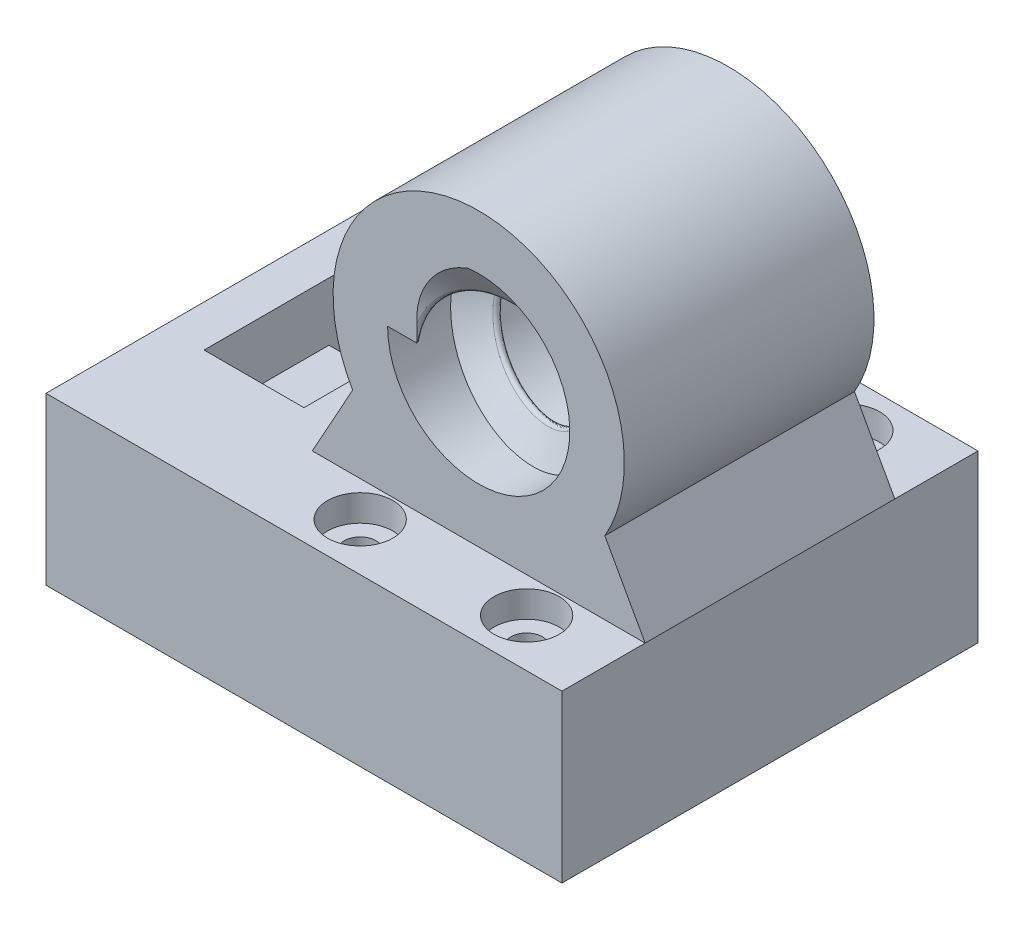
from build123d import *

# Parameters (mm, degrees)
SKETCH1_R           = 17.5
BOSS_EXTRUDE1_DEPTH = 30
SKETCH5_R           = 10.9500003
CUT_EXTRUDE2_DEPTH  = 39.890872965
SWEEP2_PITCH        = 10
SKETCH8_R           = 17.5
CUT_EXTRUDE3_DEPTH  = 41.699000034
SKETCH9_R           = 17.5
CUT_EXTRUDE4_DEPTH  = 39.890873595
SKETCH10_W          = 40
SKETCH10_H          = 19.97726246
BOSS_EXTRUDE2_DEPTH = 40
SKETCH11_W          = 40
SKETCH11_H          = 19.97726246
BOSS_EXTRUDE3_DEPTH = 10
BOSS_EXTRUDE4_DEPTH = 30
SKETCH14_R          = 1.905
CUT_EXTRUDE5_DEPTH  = 71.869594345
SKETCH15_R          = 3.9243
CUT_EXTRUDE7_DEPTH  = 59.798031253
SKETCH16_W          = 50
SKETCH16_H          = 19.97726246
BOSS_EXTRUDE5_DEPTH = 22
CUT_EXTRUDE8_DEPTH  = 12


with BuildPart() as part:
    # Sketch1 → Boss-Extrude1 (new body)
    with BuildSketch(Plane.XY):
        Circle(SKETCH1_R)
    extrude(amount=BOSS_EXTRUDE1_DEPTH)

    # Sketch5 → Cut-Extrude2 (cut, through all)
    with BuildSketch(Plane(origin=(0, 0, 0), x_dir=(-1, 0, 0), z_dir=(0, 0, -1))):
        Circle(SKETCH5_R)
    extrude(amount=-CUT_EXTRUDE2_DEPTH, mode=Mode.SUBTRACT)

    # Sweep2: arcs per turn and ends read off the stored shape
    # Sweep2: the profile of Sketch7 profile screwed along a right-hand helix through 3.75 turns, 16 arcs to a turn; built about Z, then put on its axis
    sweep2_z = Axis((0, 0, 0), (0, 0, 1))
    sweep2_corners = [(0, 7.7000003, 2.933012702), (0, 10.9503003, 4.809574282), (0, 10.9503003, 0.190425718), (0, 7.7000003, 2.066987298), (0, 7.4500003, 2.5)]
    with BuildLine(mode=Mode.PRIVATE) as sweep2_profile:
        Line(sweep2_corners[0], sweep2_corners[1])
        Line(sweep2_corners[1], sweep2_corners[2])
        Line(sweep2_corners[2], sweep2_corners[3])
        ThreePointArc((0, 7.7000003, 2.066987298), (0, 7.516987598, 2.25), (0, 7.4500003, 2.5))
        ThreePointArc((0, 7.4500003, 2.5), (0, 7.516987598, 2.75), (0, 7.7000003, 2.933012702))
    sweep2_cap = Face(sweep2_profile.wire())
    sweep2_arcs = [((0, 7.7000003, 2.066987298), (0, 7.4500003, 2.211324865), (0, 7.4500003, 2.5), (1, 0.8660254037844395, 1)), ((0, 7.4500003, 2.5), (0, 7.4500003, 2.788675135), (0, 7.7000003, 2.933012702), (1, 0.8660254037844395, 1))]  # start, shoulder, end, weights
    sweep2_turn_angles = [0, 11.25, 22.5, 33.75, 45, 56.25, 67.5, 78.75, 90, 101.25, 112.5, 123.75, 135, 146.25, 157.5, 168.75, 180, 191.25, 202.5, 213.75, 225, 236.25, 247.5, 258.75, 270, 281.25, 292.5, 303.75, 315, 326.25, 337.5, 348.75, 360]
    sweep2_turn_weights = [1, 0.9807852804032304, 1, 0.9807852804032304, 1, 0.9807852804032304, 1, 0.9807852804032304, 1, 0.9807852804032304, 1, 0.9807852804032304, 1, 0.9807852804032304, 1, 0.9807852804032304, 1, 0.9807852804032304, 1, 0.9807852804032304, 1, 0.9807852804032304, 1, 0.9807852804032304, 1, 0.9807852804032304, 1, 0.9807852804032304, 1, 0.9807852804032304, 1, 0.9807852804032304, 1]
    sweep2_turn_rails = [Edge.make_bspline([Vector(p[0], p[1], 0).rotate(sweep2_z, sweep2_turn_angles[k]) / sweep2_turn_weights[k] + Vector(0, 0, p[2] + SWEEP2_PITCH * sweep2_turn_angles[k] / 360) for k in range(33)], [0, 0, 0, 1, 1, 2, 2, 3, 3, 4, 4, 5, 5, 6, 6, 7, 7, 8, 8, 9, 9, 10, 10, 11, 11, 12, 12, 13, 13, 14, 14, 15, 15, 16, 16, 16], 2, sweep2_turn_weights) for p in sweep2_corners]
    sweep2_turn_sides = [*[Face.make_surface_from_curves(sweep2_turn_rails[p[0]], sweep2_turn_rails[p[1]]) for p in [(0, 1), (1, 2), (2, 3)]], *[Face.make_bezier_surface([[Vector(p[j][0], p[j][1], 0).rotate(sweep2_z, sweep2_turn_angles[2 * i + k]) / sweep2_turn_weights[2 * i + k] + Vector(0, 0, p[j][2] + SWEEP2_PITCH * sweep2_turn_angles[2 * i + k] / 360) for k in range(3)] for j in range(3)], [[p[3][j] * sweep2_turn_weights[2 * i + k] for k in range(3)] for j in range(3)]) for p in sweep2_arcs for i in range(16)]]
    sweep2_last_angles = [1080, 1091.25, 1102.5, 1113.75, 1125, 1136.25, 1147.5, 1158.75, 1170, 1181.25, 1192.5, 1203.75, 1215, 1226.25, 1237.5, 1248.75, 1260, 1271.25, 1282.5, 1293.75, 1305, 1316.25, 1327.5, 1338.75, 1350]
    sweep2_last_weights = [1, 0.9807852804032304, 1, 0.9807852804032304, 1, 0.9807852804032304, 1, 0.9807852804032304, 1, 0.9807852804032304, 1, 0.9807852804032304, 1, 0.9807852804032304, 1, 0.9807852804032304, 1, 0.9807852804032304, 1, 0.9807852804032304, 1, 0.9807852804032304, 1, 0.9807852804032304, 1]
    sweep2_last_rails = [Edge.make_bspline([Vector(p[0], p[1], 0).rotate(sweep2_z, sweep2_last_angles[k]) / sweep2_last_weights[k] + Vector(0, 0, p[2] + SWEEP2_PITCH * sweep2_last_angles[k] / 360) for k in range(25)], [0, 0, 0, 1, 1, 2, 2, 3, 3, 4, 4, 5, 5, 6, 6, 7, 7, 8, 8, 9, 9, 10, 10, 11, 11, 12, 12, 12], 2, sweep2_last_weights) for p in sweep2_corners]
    sweep2_last_sides = [*[Face.make_surface_from_curves(sweep2_last_rails[p[0]], sweep2_last_rails[p[1]]) for p in [(0, 1), (1, 2), (2, 3)]], *[Face.make_bezier_surface([[Vector(p[j][0], p[j][1], 0).rotate(sweep2_z, sweep2_last_angles[2 * i + k]) / sweep2_last_weights[2 * i + k] + Vector(0, 0, p[j][2] + SWEEP2_PITCH * sweep2_last_angles[2 * i + k] / 360) for k in range(3)] for j in range(3)], [[p[3][j] * sweep2_last_weights[2 * i + k] for k in range(3)] for j in range(3)]) for p in sweep2_arcs for i in range(12)]]
    sweep2 = Plane(origin=(0, 0, -10), x_dir=(-1, 0, 0), z_dir=(0, 0, 1)) * Solid(Shell([*[p.moved(Location((0, 0, SWEEP2_PITCH * i))) for i in range(3) for p in sweep2_turn_sides], *sweep2_last_sides, sweep2_cap, sweep2_cap.rotate(sweep2_z, 1350).moved(Location((0, 0, SWEEP2_PITCH * 1350 / 360)))]))
    add(sweep2)

    # Sketch8 → Cut-Extrude3 (cut, through all)
    with BuildSketch(Plane(origin=(0, 0, 0), x_dir=(-1, 0, 0), z_dir=(0, 0, -1))):
        with Locations(Location((0, 0, 0), (0, 0, 180))):
            Circle(SKETCH8_R)
    extrude(amount=CUT_EXTRUDE3_DEPTH, mode=Mode.SUBTRACT)

    # Sketch9 → Cut-Extrude4 (cut, through all)
    with BuildSketch(Plane.XY.offset(30)):
        Circle(SKETCH9_R)
    extrude(amount=CUT_EXTRUDE4_DEPTH, mode=Mode.SUBTRACT)



with BuildPart() as body_2:
    # Sketch10 → Boss-Extrude2 (new body)
    with BuildSketch(Plane(origin=(0, 0, 0), x_dir=(-1, 0, 0), z_dir=(0, 0, -1))):
        with Locations((0, -27.48863123)):
            Rectangle(SKETCH10_W, SKETCH10_H)
    extrude(amount=-BOSS_EXTRUDE2_DEPTH)

    # Sketch11 → Boss-Extrude3 (add)
    with BuildSketch(Plane(origin=(0, 0, 0), x_dir=(-1, 0, 0), z_dir=(0, 0, -1))):
        with Locations((0, -27.48863123)):
            Rectangle(SKETCH11_W, SKETCH11_H)
    extrude(amount=BOSS_EXTRUDE3_DEPTH)


with BuildPart() as part_1:
    add(part.part)

    add(body_2.part)  # Boss-Extrude4 merges body 2
    # Sketch13 → Boss-Extrude4 (add)
    with BuildSketch(Plane(origin=(0, 0, 0), x_dir=(-1, 0, 0), z_dir=(0, 0, -1))):
        with BuildLine():
            Line((0, -17.5), (-20, -17.5))
            Line((-20, -17.5), (-15.153881321, -8.752707062))
            ThreePointArc((-15.153881321, -8.752707062), (-8.748646364, -15.156226007), (0, -17.5))
        make_face()
    boss_extrude4 = extrude(amount=-BOSS_EXTRUDE4_DEPTH)

    # Mirror1: Boss-Extrude4 across plane
    add(boss_extrude4.mirror(Plane(origin=(0, 0, 0), x_dir=(0, 0, 1), z_dir=(1, 0, 0))))

    # Sketch14 → Cut-Extrude5 (cut, through all)
    with BuildSketch(Plane.XZ.offset(37.47726246)):
        with Locations(Location((-10, 34.2426424, 0), (0, 0, 270))):
            Circle(SKETCH14_R)
        with Locations(Location((10, 34.2426424, 0), (0, 0, 270))):
            Circle(SKETCH14_R)
        with Locations(Location((-10, -4.2426424, 0), (0, 0, 270))):
            Circle(SKETCH14_R)
        with Locations(Location((10, -4.2426424, 0), (0, 0, 270))):
            Circle(SKETCH14_R)
    extrude(amount=-CUT_EXTRUDE5_DEPTH, mode=Mode.SUBTRACT)

    # Sketch15 → Cut-Extrude7 (cut, through all)
    with BuildSketch(Plane(origin=(0, -20.6734, 0), x_dir=(1, 0, 0), z_dir=(0, 1, 0))):
        with Locations(Location((-10, 4.2426424, 0), (0, 0, 270))):
            Circle(SKETCH15_R)
        with Locations(Location((10, 4.2426424, 0), (0, 0, 270))):
            Circle(SKETCH15_R)
        with Locations(Location((10, -34.2426424, 0), (0, 0, 270))):
            Circle(SKETCH15_R)
        with Locations(Location((-10, -34.2426424, 0), (0, 0, 270))):
            Circle(SKETCH15_R)
    extrude(amount=CUT_EXTRUDE7_DEPTH, mode=Mode.SUBTRACT)

    # Sketch16 → Boss-Extrude5 (add)
    with BuildSketch(Plane.ZY.offset(20)):
        with Locations((15, -27.48863123)):
            Rectangle(SKETCH16_W, SKETCH16_H)
    extrude(amount=BOSS_EXTRUDE5_DEPTH)

    # Sketch17 → Cut-Extrude8 (cut)
    with BuildSketch(Plane.ZY.offset(37)):
        Polygon((4, -24.5), (8.5, -24.5), (8.5, -29.488888421), (11, -29.488888421), (11, -24.5), (26, -24.5), (26, -17.5), (4, -17.5), align=None)
    extrude(amount=-CUT_EXTRUDE8_DEPTH, mode=Mode.SUBTRACT)


solid = part_1.part
